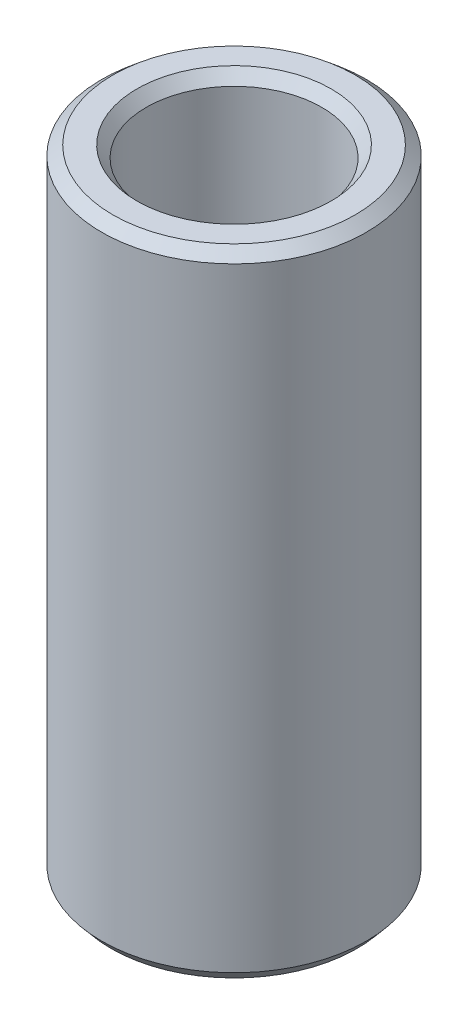
from build123d import *
from OCP.BRepFilletAPI import BRepFilletAPI_MakeChamfer

# Parameters (mm, degrees)
SKETCH1_R           = 50
BOSS_EXTRUDE1_DEPTH = 239.631027817
SKETCH2_R           = 33.131116044
CUT_EXTRUDE1_DEPTH  = 250.84601156
CHAMFER1_SIZE       = 3.562237032
CHAMFER1_SIZE2      = 4.236670008


with BuildPart() as part:
    # Sketch1 → Boss-Extrude1 (new body)
    with BuildSketch(Plane(origin=(0, 0, 0), x_dir=(1, 0, 0), z_dir=(0, 1, 0))):
        Circle(SKETCH1_R)
    extrude(amount=BOSS_EXTRUDE1_DEPTH)

    # Sketch2 → Cut-Extrude1 (cut, through all)
    with BuildSketch(Plane(origin=(0, 0, 0), x_dir=(1, 0, 0), z_dir=(0, 1, 0))):
        Circle(SKETCH2_R)
    extrude(amount=CUT_EXTRUDE1_DEPTH, mode=Mode.SUBTRACT)

    # Chamfer1: one chamfer whose edges measure the first distance from different faces: ONE call of the kernel's chamfer builder (chamfer() names one face for all edges)
    chamfer1_edges_1 = [part.edges().sort_by_distance(p)[0] for p in [
        (-33.131116044, 239.631027817, 0),
    ]]
    chamfer1_side_1 = [part.faces().sort_by_distance(p)[0] for p in [
        (-48.585786438, 239.631027817, 0),
    ]]
    chamfer1_edges_2 = [part.edges().sort_by_distance(p)[0] for p in [
        (-33.131116044, 0, 0),
    ]]
    chamfer1_side_2 = [part.faces().sort_by_distance(p)[0] for p in [
        (-33.131116044, 119.815513908, 0),
    ]]
    chamfer1_edges_3 = [part.edges().sort_by_distance(p)[0] for p in [
        (-50, 0, 0),
    ]]
    chamfer1_side_3 = [part.faces().sort_by_distance(p)[0] for p in [
        (-48.585786438, 0, 0),
    ]]
    chamfer1_edges_4 = [part.edges().sort_by_distance(p)[0] for p in [
        (-50, 239.631027817, 0),
    ]]
    chamfer1_side_4 = [part.faces().sort_by_distance(p)[0] for p in [
        (-50, 119.815513908, 0),
    ]]
    chamfer1 = BRepFilletAPI_MakeChamfer(part.part.solid().wrapped)
    for e in chamfer1_edges_1:
        chamfer1.Add(CHAMFER1_SIZE, CHAMFER1_SIZE2, e.wrapped, chamfer1_side_1[0].wrapped)  # the first distance lies on this face
    for e in chamfer1_edges_2:
        chamfer1.Add(CHAMFER1_SIZE, CHAMFER1_SIZE2, e.wrapped, chamfer1_side_2[0].wrapped)  # the first distance lies on this face
    for e in chamfer1_edges_3:
        chamfer1.Add(CHAMFER1_SIZE, CHAMFER1_SIZE2, e.wrapped, chamfer1_side_3[0].wrapped)  # the first distance lies on this face
    for e in chamfer1_edges_4:
        chamfer1.Add(CHAMFER1_SIZE, CHAMFER1_SIZE2, e.wrapped, chamfer1_side_4[0].wrapped)  # the first distance lies on this face
    add(Compound.cast(chamfer1.Shape()), mode=Mode.REPLACE)


solid = part.part
